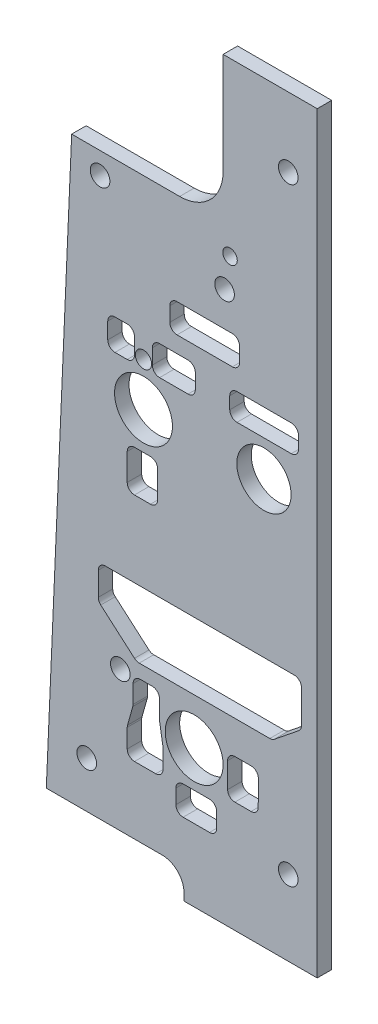
from build123d import *

# Parameters (mm, degrees)
BOSS_EXTRUDE1_DEPTH              = 3.175
F_6_CLEARANCE_HOLE1_D            = 4.3053
F_6_CLEARANCE_HOLE2_D            = 4.3053
F_9_64_0_14063_DIAMETER_HOLE1_D  = 3.572002
F_15_32_0_46875_DIAMETER_HOLE1_D = 11.90625
F_1_2_0_5_DIAMETER_HOLE1_D       = 12.7
CUT_EXTRUDE1_REACH               = 177.493
SKETCH12_W                       = 9.525
SKETCH12_H                       = 31.75
FILLET1_R                        = 9.525
SKETCH13_R                       = 1.5875
CUT_EXTRUDE2_DEPTH               = 176.493172904


with BuildPart() as part:
    # Sketch1 → Boss-Extrude1 (new body)
    with BuildSketch(Plane.XY):
        with BuildLine():
            Line((-29.21, 1.5875), (-29.21, 0))
            Line((-29.21, 0), (0, 0))
            Line((0, 0), (0, 165.1))
            Line((0, 165.1), (-25.4, 165.1))
            Line((-25.4, 165.1), (-25.4, 138.1125))
            ThreePointArc((-25.4, 138.1125), (-26.794903955, 134.744903955), (-30.1625, 133.35))
            Line((-30.1625, 133.35), (-53.848, 133.35))
            Line((-53.848, 133.35), (-59.411809524, 6.35))
            Line((-59.411809524, 6.35), (-33.9725, 6.35))
            ThreePointArc((-33.9725, 6.35), (-30.604903955, 4.955096045), (-29.21, 1.5875))
        make_face()
    extrude(amount=-BOSS_EXTRUDE1_DEPTH)

    # #6 Clearance Hole1 (through all)
    with Locations(Plane.XY):
        with Locations((-47.625, 128.5875), (-6.35, 149.86), (-50.546, 16.51), (-6.35, 16.51)):
            Hole(F_6_CLEARANCE_HOLE1_D / 2)

    # #6 Clearance Hole2 (through all)
    with Locations(Plane.XY):
        with Locations((-43.18, 37.084), (-20.32, 120.65)):
            Hole(F_6_CLEARANCE_HOLE2_D / 2)

    # 9/64 (0.14063) Diameter Hole1 (through all)
    with Locations(Plane.XY):
        with Locations((-38.1, 98.425), (-36.5125, 30.1625)):
            Hole(F_9_64_0_14063_DIAMETER_HOLE1_D / 2)

    # 15/32 (0.46875) Diameter Hole1 (through all)
    with Locations(Plane.XY):
        with Locations((-11.684, 88.9)):
            Hole(F_15_32_0_46875_DIAMETER_HOLE1_D / 2)

    # 1/2 (0.5) Diameter Hole1 (through all)
    with Locations(Plane.XY):
        with Locations((-38.1, 88.9), (-26.9875, 30.1625)):
            Hole(F_1_2_0_5_DIAMETER_HOLE1_D / 2)

    # Sketch12 → Cut-Extrude1 (cut, up to next)
    with BuildSketch(Plane.XY, mode=Mode.PRIVATE) as cut_extrude1_sk1:
        with Locations((-25.4, 149.225)):
            Rectangle(SKETCH12_W, SKETCH12_H)
    cut_extrude1_tool1 = extrude(cut_extrude1_sk1.sketch, amount=-CUT_EXTRUDE1_REACH, mode=Mode.PRIVATE) & part.part
    add(cut_extrude1_tool1.solids().sort_by_distance((-25.4, 149.225, 0))[0], mode=Mode.SUBTRACT)

    # Fillet1
    fillet1_edges = [part.edges().sort_by_distance(p)[0] for p in [
        (-20.6375, 133.35, -1.5875),
    ]]
    fillet(fillet1_edges, radius=FILLET1_R)

    # Sketch13 → Cut-Extrude2 (cut, through all)
    with BuildSketch(Plane.XY):
        with Locations((-19.119649608, 127.498250121)):
            Circle(SKETCH13_R)
        with BuildLine():
            Line((-30.747750154, 113.086358247), (-18.616014186, 113.086358247))
            ThreePointArc((-18.616014186, 113.086358247), (-17.493482171, 112.621390263), (-17.028514186, 111.498858247))
            Line((-17.028514186, 111.498858247), (-17.028514186, 108.358274098))
            ThreePointArc((-17.028514186, 108.358274098), (-17.493482171, 107.235742083), (-18.616014186, 106.770774098))
            Line((-18.616014186, 106.770774098), (-30.747750154, 106.770774098))
            ThreePointArc((-30.747750154, 106.770774098), (-31.870282169, 107.235742083), (-32.335250154, 108.358274098))
            Line((-32.335250154, 108.358274098), (-32.335250154, 111.498858247))
            ThreePointArc((-32.335250154, 111.498858247), (-31.870282169, 112.621390263), (-30.747750154, 113.086358247))
        make_face()
        with BuildLine():
            Line((-34.574215894, 103.194925639), (-28.325502594, 103.194925639))
            ThreePointArc((-28.325502594, 103.194925639), (-27.202970578, 102.729957655), (-26.738002594, 101.607425639))
            Line((-26.738002594, 101.607425639), (-26.738002594, 98.325945681))
            ThreePointArc((-26.738002594, 98.325945681), (-27.202970578, 97.203413666), (-28.325502594, 96.738445681))
            Line((-28.325502594, 96.738445681), (-34.574215894, 96.738445681))
            ThreePointArc((-34.574215894, 96.738445681), (-35.696747909, 97.203413666), (-36.161715894, 98.325945681))
            Line((-36.161715894, 98.325945681), (-36.161715894, 101.607425639))
            ThreePointArc((-36.161715894, 101.607425639), (-35.696747909, 102.729957655), (-34.574215894, 103.194925639))
        make_face()
        with BuildLine():
            Line((-40.080756518, 98.224999494), (-40.080756518, 101.78556236))
            ThreePointArc((-40.080756518, 101.78556236), (-40.545724503, 102.908094375), (-41.668256518, 103.37306236))
            Line((-41.668256518, 103.37306236), (-44.352806872, 103.37306236))
            ThreePointArc((-44.352806872, 103.37306236), (-45.475338887, 102.908094375), (-45.940306872, 101.78556236))
            Line((-45.940306872, 101.78556236), (-45.940306872, 98.224999494))
            ThreePointArc((-45.940306872, 98.224999494), (-45.475338887, 97.102467479), (-44.352806872, 96.637499494))
            Line((-44.352806872, 96.637499494), (-41.668256518, 96.637499494))
            ThreePointArc((-41.668256518, 96.637499494), (-40.545724503, 97.102467479), (-40.080756518, 98.224999494))
        make_face()
        with BuildLine():
            Line((-40.080756518, 80.759278088), (-36.575077921, 80.759278088))
            ThreePointArc((-36.575077921, 80.759278088), (-35.452545906, 80.294310103), (-34.987577921, 79.171778088))
            Line((-34.987577921, 79.171778088), (-34.987577921, 73.287722615))
            ThreePointArc((-34.987577921, 73.287722615), (-35.452545906, 72.165190599), (-36.575077921, 71.700222615))
            Line((-36.575077921, 71.700222615), (-40.080756518, 71.700222615))
            ThreePointArc((-40.080756518, 71.700222615), (-41.203288533, 72.165190599), (-41.668256518, 73.287722615))
            Line((-41.668256518, 73.287722615), (-41.668256518, 79.171778088))
            ThreePointArc((-41.668256518, 79.171778088), (-41.203288533, 80.294310103), (-40.080756518, 80.759278088))
        make_face()
        with BuildLine():
            Line((-17.594401847, 102.582143881), (-5.696041939, 102.582143881))
            ThreePointArc((-5.696041939, 102.582143881), (-4.573509924, 102.117175896), (-4.108541939, 100.994643881))
            Line((-4.108541939, 100.994643881), (-4.108541939, 98.325945681))
            ThreePointArc((-4.108541939, 98.325945681), (-4.573509924, 97.203413666), (-5.696041939, 96.738445681))
            Line((-5.696041939, 96.738445681), (-17.594401847, 96.738445681))
            ThreePointArc((-17.594401847, 96.738445681), (-18.716933862, 97.203413666), (-19.181901847, 98.325945681))
            Line((-19.181901847, 98.325945681), (-19.181901847, 100.994643881))
            ThreePointArc((-19.181901847, 100.994643881), (-18.716933862, 102.117175896), (-17.594401847, 102.582143881))
        make_face()
        with BuildLine():
            Line((-48.019090356, 53.428082865), (-48.019090356, 48.29494575))
            ThreePointArc((-48.019090356, 48.29494575), (-47.875751507, 47.635738028), (-47.471619717, 47.095572923))
            Line((-47.471619717, 47.095572923), (-40.072250924, 40.679252143))
            ThreePointArc((-40.072250924, 40.679252143), (-39.587267456, 40.391318578), (-39.032221563, 40.291124971))
            Line((-39.032221563, 40.291124971), (-10.394396549, 40.291124971))
            ThreePointArc((-10.394396549, 40.291124971), (-9.86658968, 40.381435551), (-9.398835151, 40.642092014))
            Line((-9.398835151, 40.642092014), (-4.044428972, 44.953048769))
            ThreePointArc((-4.044428972, 44.953048769), (-3.608101763, 45.50412475), (-3.45249037, 46.189581725))
            Line((-3.45249037, 46.189581725), (-3.45249037, 53.428082865))
            ThreePointArc((-3.45249037, 53.428082865), (-3.917458355, 54.55061488), (-5.03999037, 55.015582865))
            Line((-5.03999037, 55.015582865), (-46.431590356, 55.015582865))
            ThreePointArc((-46.431590356, 55.015582865), (-47.554122371, 54.55061488), (-48.019090356, 53.428082865))
        make_face()
        with BuildLine():
            Line((-40.384497263, 35.736689818), (-40.384497263, 31.765164549))
            ThreePointArc((-40.384497263, 31.765164549), (-40.399363489, 31.548417545), (-40.443683737, 31.335730019))
            Line((-40.443683737, 31.335730019), (-41.604871442, 27.203181856))
            ThreePointArc((-41.604871442, 27.203181856), (-41.64919169, 26.99049433), (-41.664057916, 26.773747326))
            Line((-41.664057916, 26.773747326), (-41.664057916, 22.672560488))
            ThreePointArc((-41.664057916, 22.672560488), (-41.199089931, 21.550028473), (-40.076557916, 21.085060488))
            Line((-40.076557916, 21.085060488), (-35.415894114, 21.085060488))
            ThreePointArc((-35.415894114, 21.085060488), (-34.293362099, 21.550028473), (-33.828394114, 22.672560488))
            Line((-33.828394114, 22.672560488), (-33.828394114, 26.863403798))
            ThreePointArc((-33.828394114, 26.863403798), (-33.833620786, 26.992118078), (-33.849266386, 27.119984802))
            Line((-33.849266386, 27.119984802), (-34.553343622, 31.418927073))
            ThreePointArc((-34.553343622, 31.418927073), (-34.568989222, 31.546793797), (-34.574215894, 31.675508077))
            Line((-34.574215894, 31.675508077), (-34.574215894, 35.736689818))
            ThreePointArc((-34.574215894, 35.736689818), (-35.039183879, 36.859221833), (-36.161715894, 37.324189818))
            Line((-36.161715894, 37.324189818), (-38.796997263, 37.324189818))
            ThreePointArc((-38.796997263, 37.324189818), (-39.919529278, 36.859221833), (-40.384497263, 35.736689818))
        make_face()
        with BuildLine():
            Line((-29.406515481, 22.159407852), (-23.623512078, 22.159407852))
            ThreePointArc((-23.623512078, 22.159407852), (-22.500980063, 21.694439868), (-22.036012078, 20.571907852))
            Line((-22.036012078, 20.571907852), (-22.036012078, 17.427443633))
            ThreePointArc((-22.036012078, 17.427443633), (-22.500980063, 16.304911618), (-23.623512078, 15.839943633))
            Line((-23.623512078, 15.839943633), (-29.406515481, 15.839943633))
            ThreePointArc((-29.406515481, 15.839943633), (-30.529047497, 16.304911618), (-30.994015481, 17.427443633))
            Line((-30.994015481, 17.427443633), (-30.994015481, 20.571907852))
            ThreePointArc((-30.994015481, 20.571907852), (-30.529047497, 21.694439868), (-29.406515481, 22.159407852))
        make_face()
        with BuildLine():
            Line((-19.652205933, 31.45310542), (-19.652205933, 25.961326294))
            ThreePointArc((-19.652205933, 25.961326294), (-19.187237948, 24.838794279), (-18.064705933, 24.373826294))
            Line((-18.064705933, 24.373826294), (-14.523884595, 24.373826294))
            ThreePointArc((-14.523884595, 24.373826294), (-13.404315452, 24.835839206), (-12.936406656, 25.952957085))
            Line((-12.936406656, 25.952957085), (-12.907453911, 31.444736212))
            ThreePointArc((-12.907453911, 31.444736212), (-13.369444762, 32.572674563), (-14.49493185, 33.04060542))
            Line((-14.49493185, 33.04060542), (-18.064705933, 33.04060542))
            ThreePointArc((-18.064705933, 33.04060542), (-19.187237948, 32.575637435), (-19.652205933, 31.45310542))
        make_face()
    extrude(amount=-CUT_EXTRUDE2_DEPTH, mode=Mode.SUBTRACT)


solid = part.part
